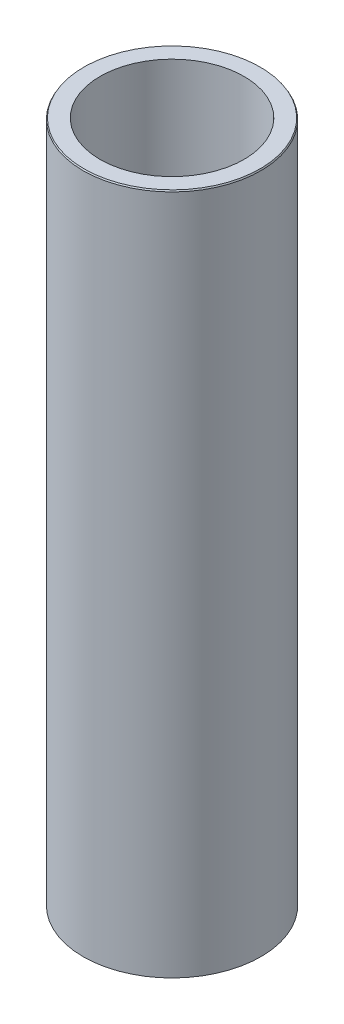
from build123d import *
from OCP.BRepFilletAPI import BRepFilletAPI_MakeChamfer

# Parameters (mm, degrees)
SKETCH1_R           = 57.5
BOSS_EXTRUDE1_DEPTH = 441.658176755
SKETCH2_R           = 46.565812804
CUT_EXTRUDE1_DEPTH  = 450.081779963
CHAMFER1_SIZE       = 0.838770635
CHAMFER1_SIZE2      = 0.484264452


with BuildPart() as part:
    # Sketch1 → Boss-Extrude1 (new body)
    with BuildSketch(Plane(origin=(0, 0, 0), x_dir=(1, 0, 0), z_dir=(0, 1, 0))):
        Circle(SKETCH1_R)
    extrude(amount=BOSS_EXTRUDE1_DEPTH)

    # Sketch2 → Cut-Extrude1 (cut, through all)
    with BuildSketch(Plane(origin=(0, 0, 0), x_dir=(1, 0, 0), z_dir=(0, 1, 0))):
        Circle(SKETCH2_R)
    extrude(amount=CUT_EXTRUDE1_DEPTH, mode=Mode.SUBTRACT)

    # Chamfer1: one chamfer whose edges measure the first distance from different faces: ONE call of the kernel's chamfer builder (chamfer() names one face for all edges)
    chamfer1_edges_1 = [part.edges().sort_by_distance(p)[0] for p in [
        (-57.5, 441.658176755, 0),
    ]]
    chamfer1_side_1 = [part.faces().sort_by_distance(p)[0] for p in [
        (-57.5, 220.829088377, 0),
    ]]
    chamfer1_edges_2 = [part.edges().sort_by_distance(p)[0] for p in [
        (-57.5, 0, 0),
    ]]
    chamfer1_side_2 = [part.faces().sort_by_distance(p)[0] for p in [
        (-55.873654403, 0, 0),
    ]]
    chamfer1 = BRepFilletAPI_MakeChamfer(part.part.solid().wrapped)
    for e in chamfer1_edges_1:
        chamfer1.Add(CHAMFER1_SIZE, CHAMFER1_SIZE2, e.wrapped, chamfer1_side_1[0].wrapped)  # the first distance lies on this face
    for e in chamfer1_edges_2:
        chamfer1.Add(CHAMFER1_SIZE, CHAMFER1_SIZE2, e.wrapped, chamfer1_side_2[0].wrapped)  # the first distance lies on this face
    add(Compound.cast(chamfer1.Shape()), mode=Mode.REPLACE)


solid = part.part
